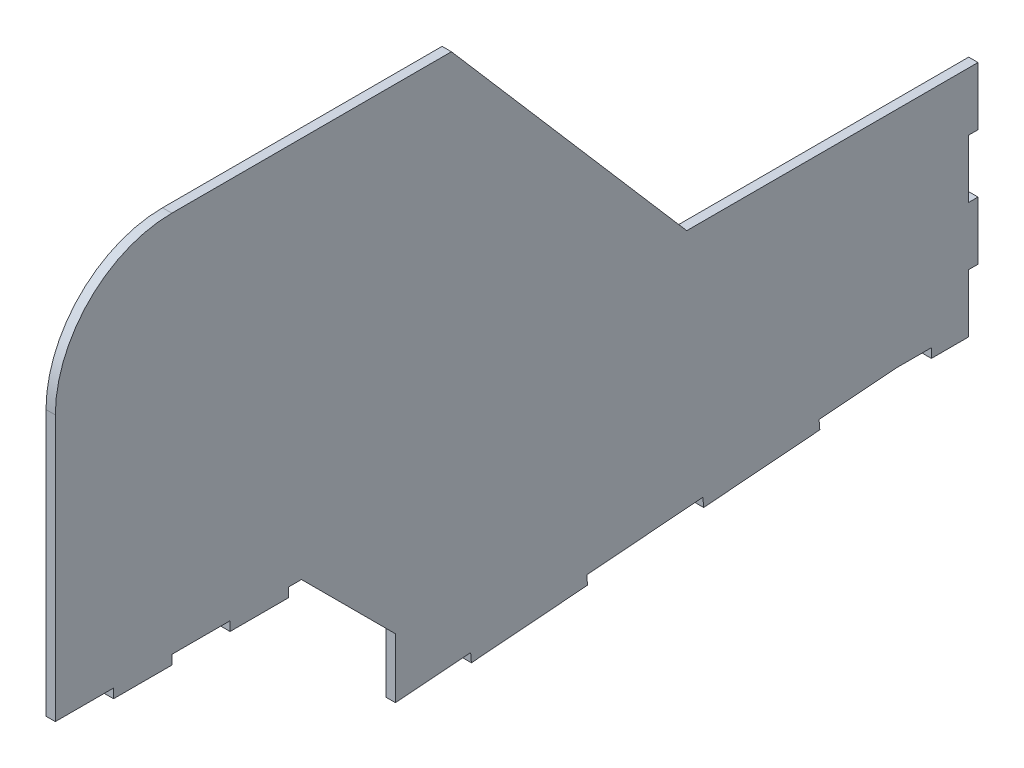
from build123d import *

# Parameters (mm, degrees)
SALIENTE_EXTRUIR1_DEPTH = 4
CROQUIS3_W              = 4
CROQUIS3_H              = 25
CORTAR_EXTRUIR1_DEPTH   = 10
SALIENTE_EXTRUIR2_DEPTH = 4
CROQUIS5_W              = 15
CROQUIS5_H              = 4
CORTAR_EXTRUIR2_DEPTH   = 10
CORTAR_EXTRUIR3_DEPTH   = 10
CORTAR_EXTRUIR4_DEPTH   = 246.562228773


with BuildPart() as part:
    # Croquis2 → Saliente-Extruir1 (new body)
    with BuildSketch(Plane(origin=(0, 0, 0), x_dir=(0, 0, -1), z_dir=(1, 0, 0))):
        Polygon((-196, 89), (-196, -75), (-90.353418897, -75), (-50, -115.353418897), (-50, -145), (165, -128), (200, -128), (200, -28), (75, -28), (-26, 89), align=None)
    extrude(amount=SALIENTE_EXTRUIR1_DEPTH)

    # Croquis3 → Cortar-Extruir1 (cut)
    with BuildSketch(Plane(origin=(4, 0, 0), x_dir=(0, 0, -1), z_dir=(1, 0, 0))):
        with Locations((198, -65.5)):
            Rectangle(CROQUIS3_W, CROQUIS3_H)
        with Locations((198, -115.5)):
            Rectangle(CROQUIS3_W, CROQUIS3_H)
    extrude(amount=-CORTAR_EXTRUIR1_DEPTH, mode=Mode.SUBTRACT)

    # Croquis4 → Saliente-Extruir2 (add)
    with BuildSketch(Plane(origin=(4, 0, 0), x_dir=(0, 0, -1), z_dir=(1, 0, 0))):
        Polygon((-196, -75), (-171, -75), (-171, -79), (-146, -79), (-146, -75), (-121, -75), (-121, -79), (-96, -79), (-96, -75), (-71, -75), (-71, -79), (-46, -79), (-46, -75), (-21, -75), (-21, -79), (4, -79), (4, -43.966541651), (4, -42.504718563), (-196, -42.504718563), align=None)
    extrude(amount=-SALIENTE_EXTRUIR2_DEPTH)

    # Croquis5 → Cortar-Extruir2 (cut)
    with BuildSketch(Plane(origin=(4, 0, 0), x_dir=(0, 0, -1), z_dir=(1, 0, 0))):
        with Locations((172.5, -126)):
            Rectangle(CROQUIS5_W, CROQUIS5_H)
    extrude(amount=-CORTAR_EXTRUIR2_DEPTH, mode=Mode.SUBTRACT)

    # Croquis6 → Cortar-Extruir3 (cut)
    with BuildSketch(Plane(origin=(4, 0, 0), x_dir=(0, 0, -1), z_dir=(1, 0, 0))):
        Polygon((165, -128), (132.102677258, -130.601183659), (131.786398188, -126.601183659), (164.68372093, -124), (165, -124), (167.067251834, -124), (167.067251834, -128), align=None)
        Polygon((82.258248862, -134.54237102), (32.413820465, -138.483558382), (32.097541395, -134.483558382), (81.941969792, -130.54237102), align=None)
        Polygon((-50.327930673, -145.025929402), (-17.430607931, -142.424745743), (-17.746887001, -138.424745743), (-50.644209743, -141.025929402), align=None)
    extrude(amount=-CORTAR_EXTRUIR3_DEPTH, mode=Mode.SUBTRACT)

    # Croquis7 → Cortar-Extruir4 (cut, through all)
    with BuildSketch(Plane(origin=(4, 0, 0), x_dir=(0, 0, -1), z_dir=(1, 0, 0))):
        with BuildLine():
            Line((-146, 89), (-196, 89))
            Line((-196, 89), (-196, 39))
            ThreePointArc((-196, 39), (-181.355339059, 74.355339059), (-146, 89))
        make_face()
    extrude(amount=-CORTAR_EXTRUIR4_DEPTH, mode=Mode.SUBTRACT)


solid = part.part
